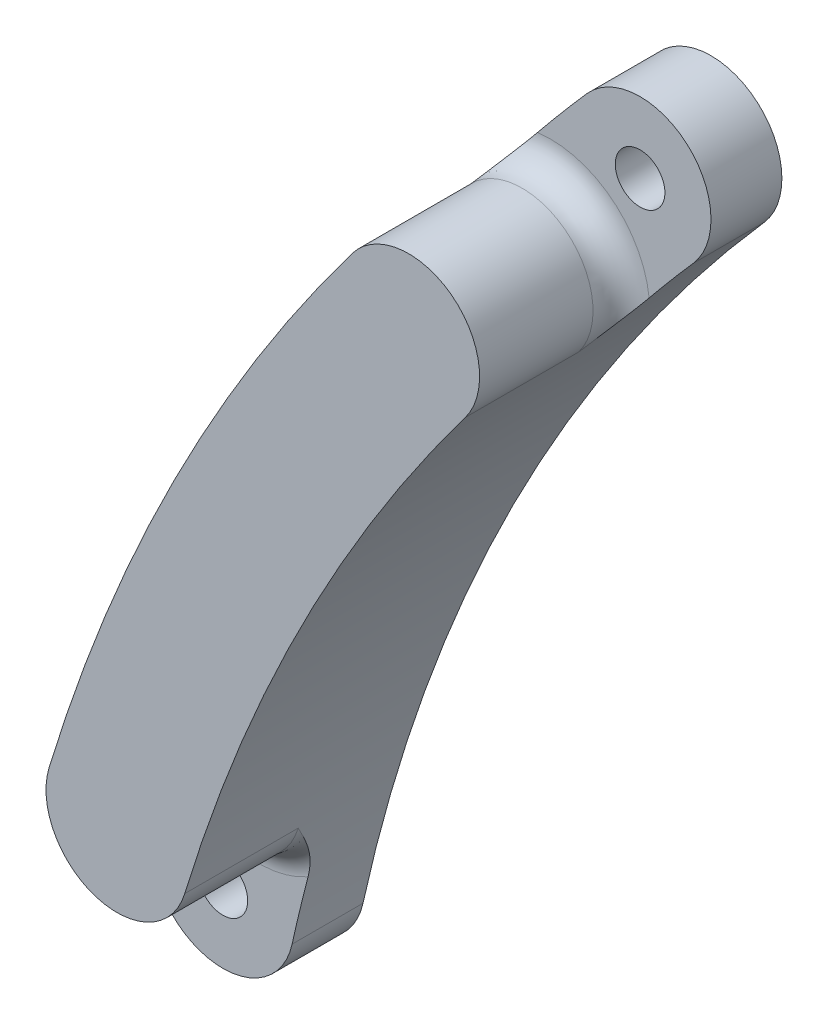
from build123d import *

# Parameters (mm, degrees)
ESQUISSE1_R        = 1.7499999999999998
ESQUISSE1_R_2      = 1.7500000000000004
BOSS_EXTRU_1_DEPTH = 5
BOSS_EXTRU_2_DEPTH = 10
CONG_1_R           = 2


with BuildPart() as part:
    # Esquisse1 → Boss.-Extru.1 (new body)
    with BuildSketch(Plane.XY):
        with BuildLine():
            ThreePointArc((25.67255914111772, 61.26515899878016), (6.5724948103165275, 33.1115304538809), (-4.882655819629511, 1.0768807487543617))
            ThreePointArc((-4.882655819629511, 1.0768807487543617), (-1.0768807487543604, -4.88265581962951), (4.882655819629526, -1.0768807487543648))
            ThreePointArc((4.882655819629526, -1.0768807487543648), (15.489276773283322, 28.5848319411776), (33.17452152402515, 54.65300651978803))
            ThreePointArc((33.17452152402515, 54.65300651978803), (32.7296165720675, 61.710063950737826), (25.67255914111772, 61.26515899878016))
        make_face()
        Circle(ESQUISSE1_R, mode=Mode.SUBTRACT)
        with Locations((29.423540332571427, 57.9590827592841)):
            Circle(ESQUISSE1_R_2, mode=Mode.SUBTRACT)
    extrude(amount=BOSS_EXTRU_1_DEPTH)

    # Esquisse2 → Boss.-Extru.2 (add)
    with BuildSketch(Plane.XY.offset(5)):
        with BuildLine():
            ThreePointArc((19.110808324151332, 53.216329089878414), (6.572494810316485, 33.11153045388086), (-2.2576776060294588, 11.12425483676938))
            ThreePointArc((-2.2576776060294588, 11.12425483676938), (1.0787510833043994, 4.889814717481248), (7.313191202592563, 8.226243406815092))
            ThreePointArc((7.313191202592563, 8.226243406815092), (15.489276773283265, 28.58483194117756), (27.098826323130343, 47.20038623376789))
            ThreePointArc((27.098826323130343, 47.20038623376789), (26.112788751696094, 54.20236666131267), (19.110808324151332, 53.216329089878414))
        make_face()
    extrude(amount=BOSS_EXTRU_2_DEPTH)

    # Congé1
    cong_1_edges = [part.edges().sort_by_distance(p)[0] for p in [
        (26.1127887516961, 54.20236666131266, 5),
    ]]
    fillet(cong_1_edges, radius=CONG_1_R)
    cong_1_2_edges = [part.edges().sort_by_distance(p)[0] for p in [
        (1.0787510833044147, 4.8898147174812445, 5),
    ]]
    fillet(cong_1_2_edges, radius=CONG_1_R)


solid = part.part
